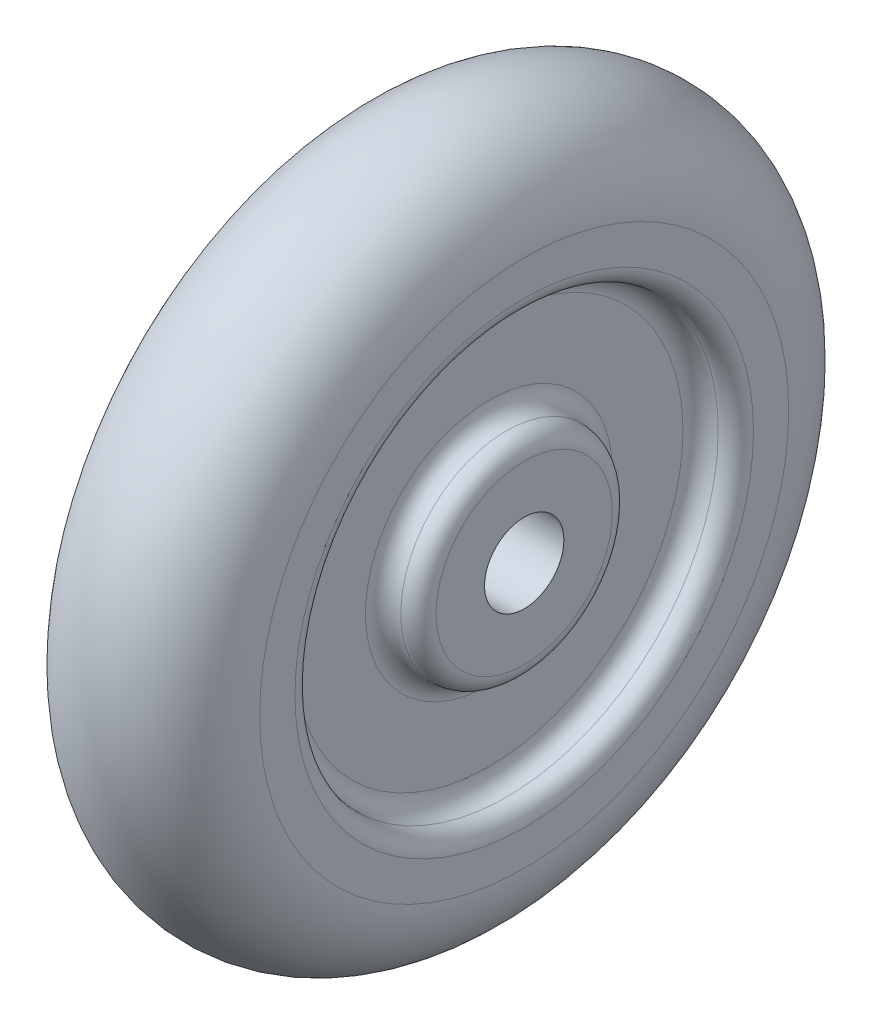
from build123d import *

# Parameters (mm, degrees)
SKETCH2_R            = 12
SKETCH2_R_2          = 6
CUT_EXTRUDE1_DEPTH   = 2
FILLET3_R            = 1
FILLET3_OF_MIRROR2_R = 1


with BuildPart() as part:
    # Sketch1 → Revolve1 (revolve)
    with BuildSketch(Plane.XY, mode=Mode.PRIVATE) as revolve1_sk:
        with BuildLine():
            Line((-5, 15), (-5, 2.25))
            Line((-5, 2.25), (5, 2.25))
            Line((5, 2.25), (5, 15))
            ThreePointArc((5, 15), (0, 20), (-5, 15))
        make_face()
    revolve(revolve1_sk.sketch.rotate(Axis((0, 0, 0), (-1, 0, 0)), 90), axis=Axis((0, 0, 0), (-1, 0, 0)))

    # Sketch2 → Cut-Extrude1 (cut)
    with BuildSketch(Plane(origin=(5, 0, 0), x_dir=(0, 0, -1), z_dir=(1, 0, 0))):
        Circle(SKETCH2_R)
        Circle(SKETCH2_R_2, mode=Mode.SUBTRACT)
    cut_extrude1 = extrude(amount=-CUT_EXTRUDE1_DEPTH, mode=Mode.SUBTRACT)

    # Fillet3
    fillet3_edges = [part.edges().sort_by_distance(p)[0] for p in [
        (3, 0, 12),
        (3, 0, 6),
    ]]
    fillet(fillet3_edges, radius=FILLET3_R)
    fillet3_2_edges = [part.edges().sort_by_distance(p)[0] for p in [
        (5, 0, 12),
        (5, 0, 6),
    ]]
    fillet(fillet3_2_edges, radius=FILLET3_R - 0.0001)  # a hair under: the kernel refuses the full size

    # Mirror2: Cut-Extrude1 across plane
    add(cut_extrude1.mirror(Plane(origin=(0, 0, 0), x_dir=(0, 0, 1), z_dir=(1, 0, 0))), mode=Mode.SUBTRACT)

    # Fillet3 of Mirror2
    fillet3_of_mirror2_edges = [part.edges().sort_by_distance(p)[0] for p in [
        (-3, 0, 12),
        (-3, 0, 6),
    ]]
    fillet(fillet3_of_mirror2_edges, radius=FILLET3_OF_MIRROR2_R)
    fillet3_of_mirror2_2_edges = [part.edges().sort_by_distance(p)[0] for p in [
        (-5, 0, 12),
        (-5, 0, 6),
    ]]
    fillet(fillet3_of_mirror2_2_edges, radius=FILLET3_OF_MIRROR2_R - 0.0001)  # a hair under: the kernel refuses the full size


solid = part.part
